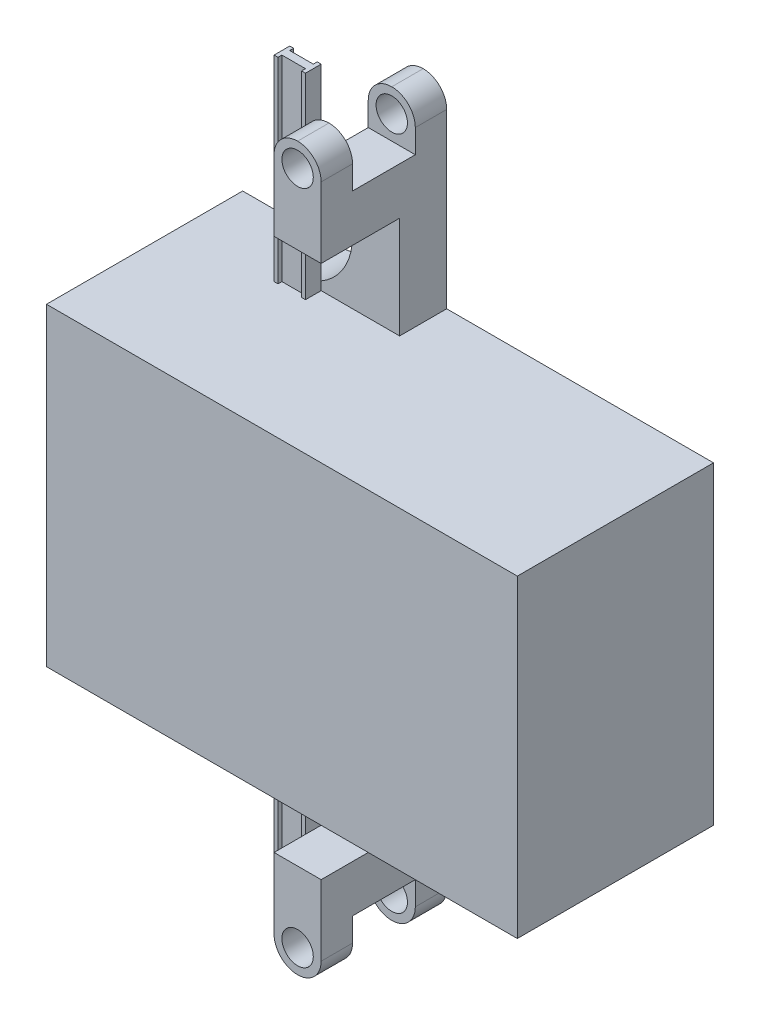
from build123d import *

# Parameters (mm, degrees)
SKETCH1_W                = 76.2
SKETCH1_H                = 50.8
BOSS_EXTRUDE1_DEPTH      = 31.75
BOSS_EXTRUDE2_DEPTH      = 31.75
BOSS_EXTRUDE2_DEPTH_BACK = 85.09
SKETCH4_W                = 5.08
SKETCH4_H                = 2.54
SKETCH4_W_2              = 7.62
SKETCH4_H_2              = 7.62
FILLET1_R                = 10.16
SKETCH5_W                = 7.62
SKETCH5_H                = 7.62
BOSS_EXTRUDE3_DEPTH      = 12.7
SKETCH6_W                = 7.62
SKETCH6_H                = 2.54
CUT_EXTRUDE1_DEPTH       = 7.62
SKETCH7_W                = 7.62
SKETCH7_H                = 2.54
CUT_EXTRUDE2_DEPTH       = 7.62
SKETCH9_W                = 7.62
SKETCH9_H                = 5.08
BOSS_EXTRUDE4_DEPTH      = 7.62
SKETCH10_W               = 7.62
SKETCH10_H               = 5.08
BOSS_EXTRUDE5_DEPTH      = 7.62
FILLET2_R                = 3.81
CUT_EXTRUDE3_REACH       = 116.166
SKETCH11_R               = 2.54
CUT_EXTRUDE4_REACH       = 116.166
SKETCH12_R               = 2.54
CUT_EXTRUDE5_REACH       = 145.06
SKETCH13_W               = 3.81
SKETCH13_H               = 0.635
SKETCH14_W               = 3.81
SKETCH14_H               = 0.635
CUT_EXTRUDE6_DEPTH       = 34.29


# Some blends are built 0.0001 mm under size
with BuildPart() as part:
    # Sketch1 → Boss-Extrude1 (new body)
    with BuildSketch(Plane.XY):
        with Locations((-38.1, 25.4)):
            Rectangle(SKETCH1_W, SKETCH1_H)
    extrude(amount=BOSS_EXTRUDE1_DEPTH)

    # Sketch4 → Boss-Extrude2 (add, two sides: drawn at the far end of the back side and taken through both)
    with BuildSketch(Plane(origin=(0, 50.8, 0), x_dir=(1, 0, 0), z_dir=(0, 1, 0)).offset(-BOSS_EXTRUDE2_DEPTH_BACK)):
        with Locations((-58.42, -8.89)):
            Rectangle(SKETCH4_W, SKETCH4_H)
        with Locations((-46.99, -3.81)):
            Rectangle(SKETCH4_W_2, SKETCH4_H_2)
    extrude(amount=BOSS_EXTRUDE2_DEPTH + BOSS_EXTRUDE2_DEPTH_BACK)

    # Fillet1
    # the kernel refuses this fillet: 10.16 mm, written as the material it adds along each edge
    with BuildSketch(Plane(origin=(-50.8, 50.8, 7.62), x_dir=(-1, 0, 0), z_dir=(0, 0, -1)), Plane(origin=(-50.8, 0, 0), x_dir=(-1, 0, 0), z_dir=(0, 0, 1))) as fillet1_piece_1:
        with BuildLine():
            CenterArc((FILLET1_R, FILLET1_R), FILLET1_R, 180, 90)
            Line((0, FILLET1_R), (0, 0))
            Line((0, 0), (FILLET1_R, 0))
        make_face()
    extrude(amount=7.62)

    # Sketch5 → Boss-Extrude3 (add)
    with BuildSketch(Plane.XY.offset(7.62)):
        with Locations((-46.99, 71.12)):
            Rectangle(SKETCH5_W, SKETCH5_H)
        with Locations((-46.99, -22.86)):
            Rectangle(SKETCH5_W, SKETCH5_H)
    extrude(amount=BOSS_EXTRUDE3_DEPTH)

    # Sketch6 → Cut-Extrude1 (cut)
    with BuildSketch(Plane.XZ.offset(34.29)):
        with Locations((-46.99, 6.35)):
            Rectangle(SKETCH6_W, SKETCH6_H)
    extrude(amount=-CUT_EXTRUDE1_DEPTH, mode=Mode.SUBTRACT)

    # Sketch7 → Cut-Extrude2 (cut)
    with BuildSketch(Plane(origin=(0, 82.55, 0), x_dir=(1, 0, 0), z_dir=(0, 1, 0))):
        with Locations((-46.99, -6.35)):
            Rectangle(SKETCH7_W, SKETCH7_H)
    extrude(amount=-CUT_EXTRUDE2_DEPTH, mode=Mode.SUBTRACT)

    # Sketch9 → Boss-Extrude4 (add)
    with BuildSketch(Plane(origin=(0, -26.67, 0), x_dir=(-1, 0, 0), z_dir=(0, -1, 0))):
        with Locations((46.99, -17.78)):
            Rectangle(SKETCH9_W, SKETCH9_H)
    extrude(amount=BOSS_EXTRUDE4_DEPTH)

    # Sketch10 → Boss-Extrude5 (add)
    with BuildSketch(Plane(origin=(0, 74.93, 0), x_dir=(1, 0, 0), z_dir=(0, 1, 0))):
        with Locations((-46.99, -17.78)):
            Rectangle(SKETCH10_W, SKETCH10_H)
    extrude(amount=BOSS_EXTRUDE5_DEPTH)

    # Fillet2
    fillet2_edges = [part.edges().sort_by_distance(p)[0] for p in [
        (-43.18, 82.55, 2.54),
        (-50.8, 82.55, 2.54),
        (-43.18, 82.55, 17.78),
        (-50.8, 82.55, 17.78),
        (-50.8, -34.29, 2.54),
        (-43.18, -34.29, 2.54),
        (-50.8, -34.29, 17.78),
        (-43.18, -34.29, 17.78),
    ]]
    fillet(fillet2_edges, radius=FILLET2_R - 0.0001)  # a hair under: the kernel refuses the full size

    # Cut-Extrude3: up to this face of the body (flat: up to its plane)
    cut_extrude3_end = Plane(part.part.faces().sort_by_distance((-39.240735796, 25.146964219, 0))[0])
    # Sketch11 → Cut-Extrude3 (cut, up to the picked face)
    with BuildSketch(Plane.XY.offset(20.32), mode=Mode.PRIVATE) as cut_extrude3_sk1:
        with Locations((-46.99, 78.74)):
            Circle(SKETCH11_R)
    cut_extrude3_tool1 = split(extrude(cut_extrude3_sk1.sketch, amount=-CUT_EXTRUDE3_REACH, mode=Mode.PRIVATE), bisect_by=cut_extrude3_end, keep=Keep.BOTH, mode=Mode.PRIVATE)
    add(cut_extrude3_tool1.solids().sort_by(Axis((-46.99, 78.74, 20.32), (0, 0, -1)))[0], mode=Mode.SUBTRACT)

    # Cut-Extrude4: up to this face of the body (flat: up to its plane)
    cut_extrude4_end = Plane(part.part.faces().sort_by_distance((-39.204923448, 24.89929007, 0))[0])
    # Sketch12 → Cut-Extrude4 (cut, up to the picked face)
    with BuildSketch(Plane.XY.offset(20.32), mode=Mode.PRIVATE) as cut_extrude4_sk1:
        with Locations((-46.99, -30.48)):
            Circle(SKETCH12_R)
    cut_extrude4_tool1 = split(extrude(cut_extrude4_sk1.sketch, amount=-CUT_EXTRUDE4_REACH, mode=Mode.PRIVATE), bisect_by=cut_extrude4_end, keep=Keep.BOTH, mode=Mode.PRIVATE)
    add(cut_extrude4_tool1.solids().sort_by(Axis((-46.99, -30.48, 20.32), (0, 0, -1)))[0], mode=Mode.SUBTRACT)

    # Cut-Extrude5: up to this face of the body (flat: up to its plane)
    cut_extrude5_end = Plane(part.part.faces().sort_by_distance((-37.151107955, 50.8, 16.634474432))[0])
    # Sketch13 → Cut-Extrude5 (cut, up to the picked face)
    with BuildSketch(Plane(origin=(0, 82.55, 0), x_dir=(1, 0, 0), z_dir=(0, 1, 0)), mode=Mode.PRIVATE) as cut_extrude5_sk1:
        with Locations((-58.42, -9.8425)):
            Rectangle(SKETCH13_W, SKETCH13_H)
    cut_extrude5_tool1 = split(extrude(cut_extrude5_sk1.sketch, amount=-CUT_EXTRUDE5_REACH, mode=Mode.PRIVATE), bisect_by=cut_extrude5_end, keep=Keep.BOTH, mode=Mode.PRIVATE)
    # Sketch13 → Cut-Extrude5 (cut, up to the picked face)
    with BuildSketch(Plane(origin=(0, 82.55, 0), x_dir=(1, 0, 0), z_dir=(0, 1, 0)), mode=Mode.PRIVATE) as cut_extrude5_sk2:
        with Locations((-58.42, -7.9375)):
            Rectangle(SKETCH13_W, SKETCH13_H)
    cut_extrude5_tool2 = split(extrude(cut_extrude5_sk2.sketch, amount=-CUT_EXTRUDE5_REACH, mode=Mode.PRIVATE), bisect_by=cut_extrude5_end, keep=Keep.BOTH, mode=Mode.PRIVATE)
    add(cut_extrude5_tool1.solids().sort_by(Axis((-58.42, 82.55, 9.8425), (0, -1, 0)))[0], mode=Mode.SUBTRACT)
    add(cut_extrude5_tool2.solids().sort_by(Axis((-58.42, 82.55, 7.9375), (0, -1, 0)))[0], mode=Mode.SUBTRACT)

    # Sketch14 → Cut-Extrude6 (cut)
    with BuildSketch(Plane(origin=(0, -34.29, 0), x_dir=(-1, 0, 0), z_dir=(0, -1, 0))):
        with Locations((58.42, -9.8425)):
            Rectangle(SKETCH14_W, SKETCH14_H)
        with Locations((58.42, -7.9375)):
            Rectangle(SKETCH14_W, SKETCH14_H)
    extrude(amount=-CUT_EXTRUDE6_DEPTH, mode=Mode.SUBTRACT)


solid = part.part
